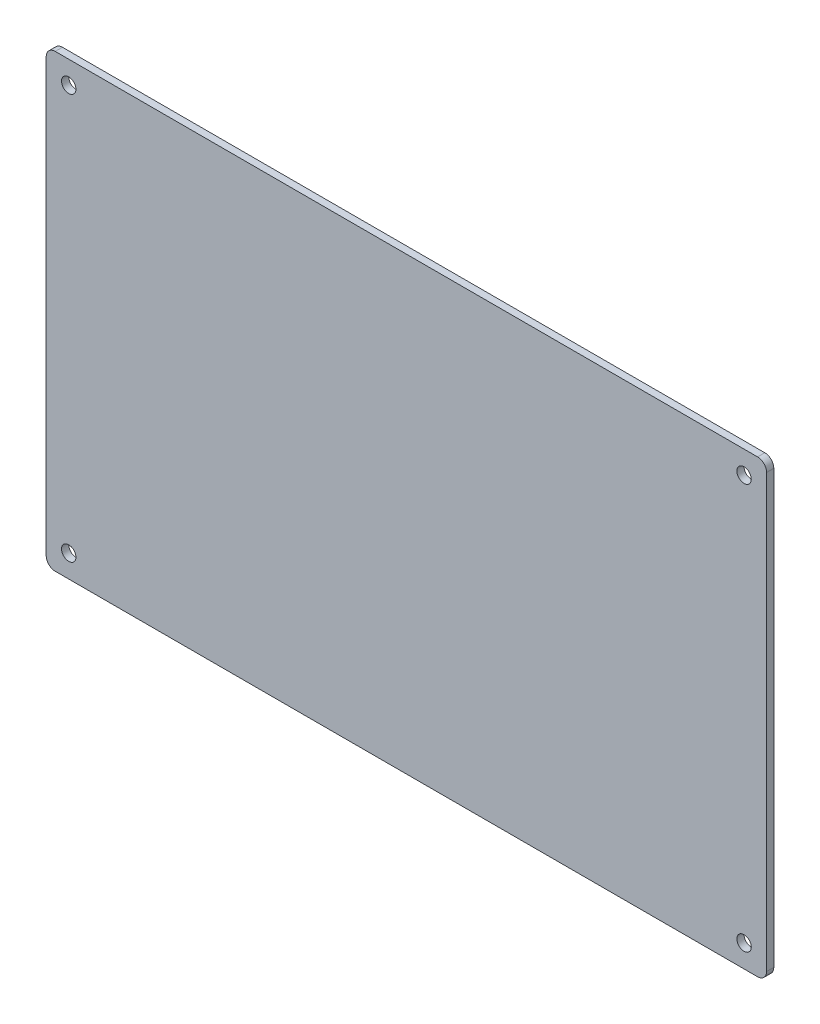
from build123d import *

# Parameters (mm, degrees)
SKETCH_1_W                 = 160
SKETCH_1_H                 = 100
EXTRUDE_1_DEPTH            = 1.6
FILLET_1_R                 = 2
HOLE_WIZARD_M3_1_OUTLINE_R = 1.6
HOLE_WIZARD_M3_1_DEPTH     = 1.6


# Read off the part's stored shape, not the designer's step: M3 すきま穴1
with BuildPart() as part:
    # ｽｹｯﾁ1 → ﾎﾞｽ - 押し出し1 (new body)
    with BuildSketch(Plane.XY):
        Rectangle(SKETCH_1_W, SKETCH_1_H)
    extrude(amount=EXTRUDE_1_DEPTH)

    # ﾌｨﾚｯﾄ1
    fillet_1_edges = [part.edges().sort_by_distance(p)[0] for p in [
        (-80, 50, 0.8),
        (80, 50, 0.8),
        (80, -50, 0.8),
        (-80, -50, 0.8),
    ]]
    fillet(fillet_1_edges, radius=FILLET_1_R)

    # M3 すきま穴1 outline → M3 すきま穴1 (cut)
    with BuildSketch(Plane.XY):
        with Locations((75, -45)):
            Circle(HOLE_WIZARD_M3_1_OUTLINE_R)
        with Locations((-75, 45)):
            Circle(HOLE_WIZARD_M3_1_OUTLINE_R)
        with Locations((-75, -45)):
            Circle(HOLE_WIZARD_M3_1_OUTLINE_R)
        with Locations((75, 45)):
            Circle(HOLE_WIZARD_M3_1_OUTLINE_R)
    extrude(amount=HOLE_WIZARD_M3_1_DEPTH, mode=Mode.SUBTRACT)


solid = part.part
